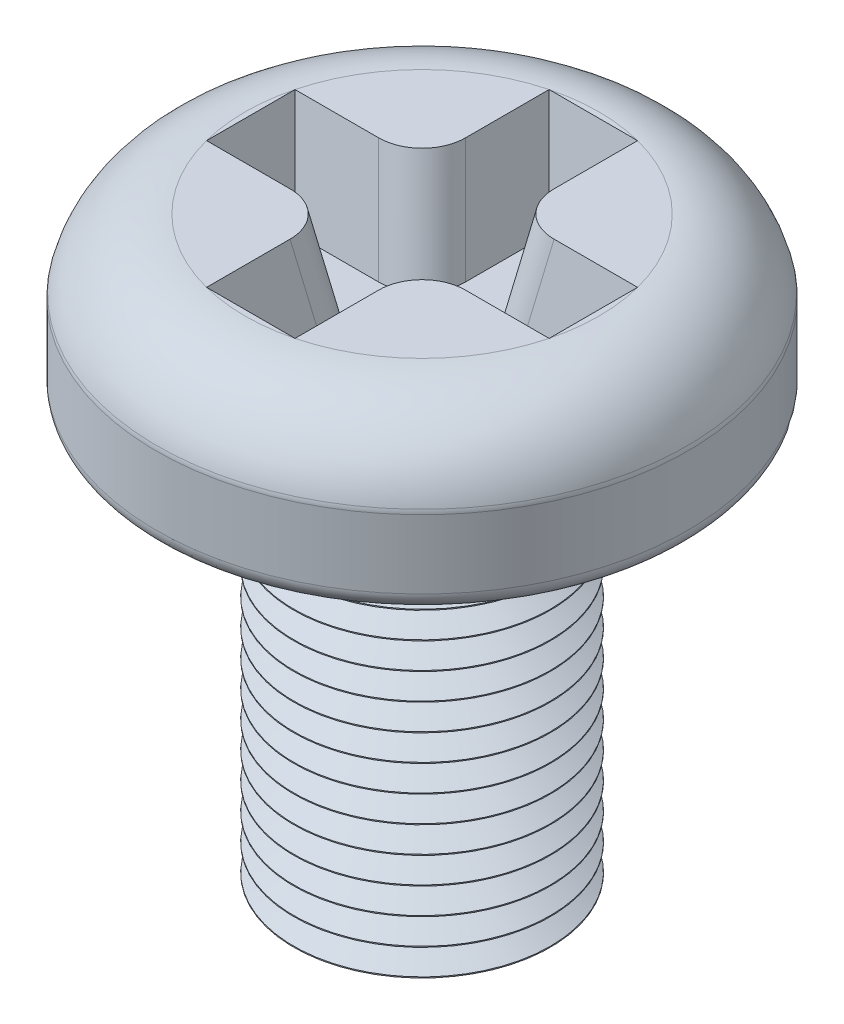
from build123d import *

# Parameters (mm, degrees)
CUT_EXTRUDE1_DEPTH = 1.2
CUT_EXTRUDE1_DRAFT = -10
FILLET1_R          = 0.5


# Read off the part's stored shape, not the designer's step: LPattern1
with BuildPart() as part:
    # Sketch1 → Revolve1 (revolve)
    with BuildSketch(Plane.XY, mode=Mode.PRIVATE) as revolve1_sk:
        with BuildLine():
            Line((0, 1.8), (0, -4.8))
            Line((0, -4.8), (1.45, -4.8))
            Line((1.45, -4.8), (1.45, 0))
            Line((1.45, 0), (2.8, 0))
            ThreePointArc((2.8, 0), (2.941421356, 0.058578644), (3, 0.2))
            Line((3, 0.2), (3, 0.976556444))
            ThreePointArc((3, 0.976556444), (2.998479065, 1.001174742), (2.993939394, 1.025418612))
            ThreePointArc((2.993939394, 1.025418612), (2.630057903, 1.583487501), (2, 1.8))
            Line((2, 1.8), (0, 1.8))
        make_face()
    revolve(revolve1_sk.sketch.rotate(Axis((0, 1.8, 0), (0, -1, 0)), 180), axis=Axis((0, 1.8, 0), (0, -1, 0)))


with BuildPart() as cut_extrude1_tool:
    # Sketch2 → Cut-Extrude1 (with draft: the straight prism first)
    with BuildSketch(Plane(origin=(0, 1.8, 0), x_dir=(1, 0, 0), z_dir=(0, 1, 0))):
        Polygon((-0.5, 1.936491673), (-0.5, 0.5), (-1.936491673, 0.5), (-1.936491673, -0.5), (-0.5, -0.5), (-0.5, -1.936491673), (0.5, -1.936491673), (0.5, -0.5), (1.936491673, -0.5), (1.936491673, 0.5), (0.5, 0.5), (0.5, 1.936491673), align=None)
    extrude(amount=-CUT_EXTRUDE1_DEPTH)
    # Cut-Extrude1: the draft: its side faces are tilted about the plane it starts from
    cut_extrude1_sides = [cut_extrude1_tool.faces().sort_by_distance(p)[0] for p in [
        (-0.5, 1.2, -1.218245837),
        (-1.218245837, 1.2, -0.5),
        (-1.936491673, 1.2, 0),
        (-1.218245837, 1.2, 0.5),
        (-0.5, 1.2, 1.218245837),
        (0, 1.2, 1.936491673),
        (0.5, 1.2, 1.218245837),
        (1.218245837, 1.2, 0.5),
        (1.936491673, 1.2, 0),
        (1.218245837, 1.2, -0.5),
        (0.5, 1.2, -1.218245837),
        (0, 1.2, -1.936491673),
    ]]
    draft(cut_extrude1_sides, Plane(origin=(0, 1.8, 0), x_dir=(1, 0, 0), z_dir=(0, 1, 0)), CUT_EXTRUDE1_DRAFT)


with BuildPart() as part_1:
    add(part.part)

    # Cut-Extrude1: cut by cut_extrude1_tool
    add(cut_extrude1_tool.part, mode=Mode.SUBTRACT)

    # Fillet1
    fillet1_edges = [part_1.edges().sort_by_distance(p)[0] for p in [
        (0.394203812, 1.2, 0.394203812),
        (-0.394203812, 1.2, 0.394203812),
        (-0.394203812, 1.2, -0.394203812),
        (0.394203812, 1.2, -0.394203812),
    ]]
    fillet(fillet1_edges, radius=FILLET1_R)

    # Sketch3 → Cut-Revolve1 (revolve, cut)
    with BuildSketch(Plane.XY, mode=Mode.PRIVATE) as cut_revolve1_sk:
        Polygon((1.759807621, -4.65), (1.759807621, -4.95), (1.459807621, -4.95), (1.2, -4.8), (1.459807621, -4.65), align=None)
    revolve(cut_revolve1_sk.sketch.rotate(Axis((0, 0, 0), (0, -1, 0)), 180), axis=Axis((0, 0, 0), (0, -1, 0)), mode=Mode.SUBTRACT)

    # LPattern1 outline → LPattern1 (revolve, cut)
    with BuildSketch(Plane.XY):
        Polygon((1.45, -3.755662433), (1.2, -3.9), (1.45, -4.044337567), align=None)
        Polygon((1.2, -3.6), (1.45, -3.744337567), (1.45, -3.455662433), align=None)
        Polygon((1.45, -4.344337567), (1.45, -4.055662433), (1.2, -4.2), align=None)
        Polygon((1.2, -3.3), (1.45, -3.444337567), (1.45, -3.155662433), align=None)
        Polygon((1.45, -4.644337567), (1.45, -4.355662433), (1.2, -4.5), align=None)
        Polygon((1.2, -3), (1.45, -3.144337567), (1.45, -2.855662433), align=None)
        Polygon((1.2, -2.7), (1.45, -2.844337567), (1.45, -2.555662433), align=None)
        Polygon((1.2, -2.4), (1.45, -2.544337567), (1.45, -2.255662433), align=None)
        Polygon((1.2, -2.1), (1.45, -2.244337567), (1.45, -1.955662433), align=None)
        Polygon((1.2, -1.8), (1.45, -1.944337567), (1.45, -1.655662433), align=None)
        Polygon((1.2, -1.5), (1.45, -1.644337567), (1.45, -1.355662433), align=None)
        Polygon((1.2, -1.2), (1.45, -1.344337567), (1.45, -1.055662433), align=None)
        Polygon((1.2, -0.9), (1.45, -1.044337567), (1.45, -0.755662433), align=None)
        Polygon((1.2, -0.6), (1.45, -0.744337567), (1.45, -0.455662433), align=None)
        Polygon((1.2, -0.3), (1.45, -0.444337567), (1.45, -0.155662433), align=None)
    revolve(axis=Axis((0, 0, 0), (0, 1, 0)), mode=Mode.SUBTRACT)


solid = part_1.part
